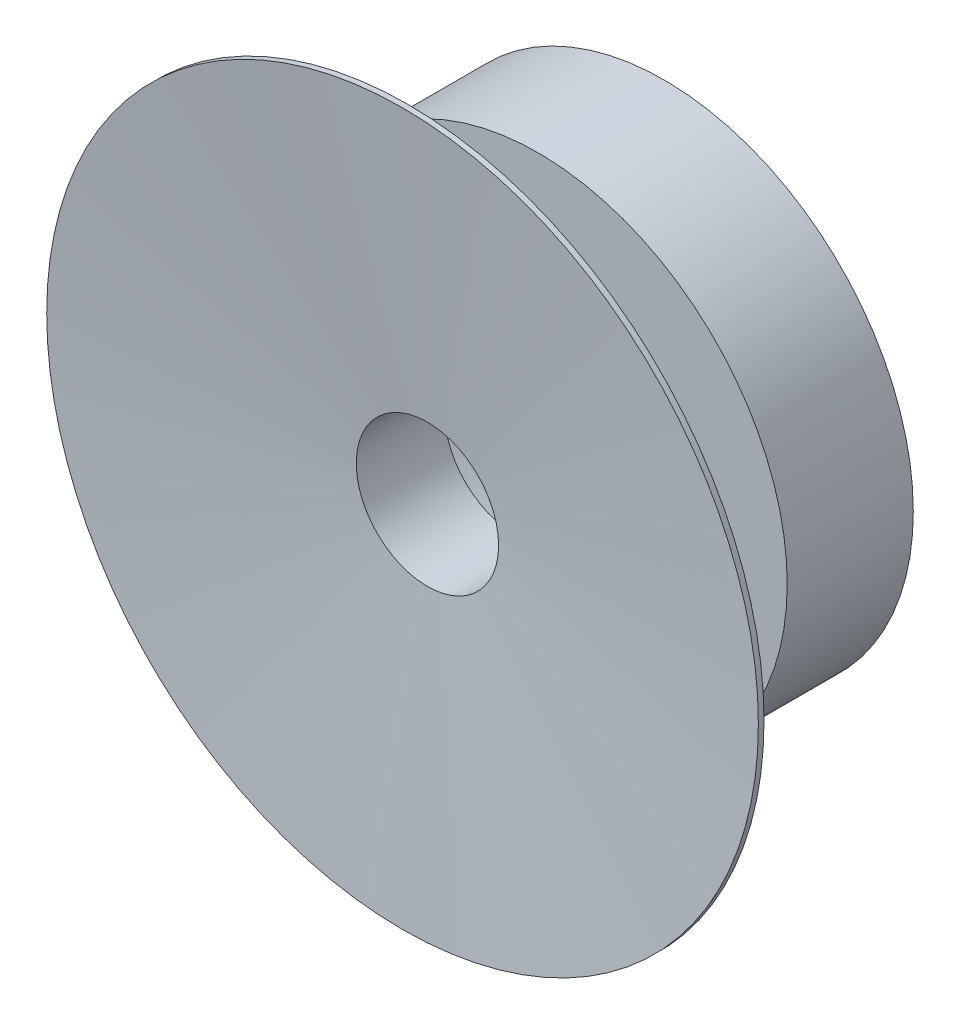
from build123d import *

# Parameters (mm, degrees)
SKETCH2_R             = 1.4732
BOSS_EXTRUDE1_DEPTH   = 10
FILLET2_R             = 3.175
CIRPATTERN2_START     = -49.5
CIRPATTERN2_OUTLINE_R = 1.4732
CIRPATTERN2_DEPTH     = 10


# Read off the part's stored shape, not the designer's step: CirPattern2
with BuildPart() as part:
    # Sketch1 → Revolve1 (revolve)
    with BuildSketch(Plane.YZ, mode=Mode.PRIVATE) as revolve1_sk:
        with BuildLine():
            ThreePointArc((-57.15, -39.5), (-43.428307314, -36.322800112), (-31.106422396, -29.5))
            Line((-31.106422396, -29.5), (-25.4, -29.5))
            Line((-25.4, -29.5), (-25.4, 2))
            Line((-25.4, 2), (-127, 10.888848214))
            Line((-127, 10.888848214), (-127, 8.881208539))
            Line((-127, 8.881208539), (-27.4, 0.167337652))
            Line((-27.4, 0.167337652), (-27.4, -23.683734158))
            ThreePointArc((-27.4, -23.683734158), (-41.079585236, -33.165904784), (-57.15, -37.5))
            Line((-57.15, -37.5), (-88.9, -37.5))
            Line((-88.9, -37.5), (-88.9, -82.5))
            Line((-88.9, -82.5), (-86.9, -82.5))
            Line((-86.9, -82.5), (-86.9, -39.5))
            Line((-86.9, -39.5), (-57.15, -39.5))
        make_face()
    revolve(revolve1_sk.sketch.rotate(Axis((0, 0, 14.051954895), (0, 0, -1)), 270), axis=Axis((0, 0, 14.051954895), (0, 0, -1)))

    # Sketch2 → Boss-Extrude1 (add)
    with BuildSketch(Plane(origin=(0, 0, -39.5), x_dir=(1, 0, 0), z_dir=(0, 0, -1))):
        with BuildLine():
            ThreePointArc((0, 57.15), (4, 57.009845641), (7.980380842, 56.590069991))
            ThreePointArc((7.980380842, 56.590069991), (29.37299875, 67.623432921), (53.425964916, 68.536678303))
            ThreePointArc((53.425964916, 68.536678303), (48.554411409, 72.069959989), (43.45, 75.257607589))
            ThreePointArc((43.45, 75.257607589), (19.913921564, 70.549566075), (0, 57.15))
        make_face()
        with Locations(Location((24.420129862, 69.15558596, 0), (0, 0, 180))):
            Circle(SKETCH2_R, mode=Mode.SUBTRACT)
    extrude(amount=BOSS_EXTRUDE1_DEPTH)

    # Fillet2
    fillet2_edges = [part.edges().sort_by_distance(p)[0] for p in [
        (53.425964916, -68.536678303, -44.5),
        (43.45, -75.257607589, -44.5),
    ]]
    fillet(fillet2_edges, radius=FILLET2_R)

    # CirPattern2 outline → CirPattern2 (add)
    # profile 1 of 11: a face of its own
    with BuildSketch(Plane.XY.offset(CIRPATTERN2_START)):
        with BuildLine():
            ThreePointArc((-21.383822454, -52.998628635), (-25.040821205, -51.371974591), (-28.575, -49.493351826))
            ThreePointArc((-28.575, -49.493351826), (-21.167907198, -66.538128805), (-8.985215302, -80.572781069))
            ThreePointArc((-8.985215302, -80.572781069), (-8.137140536, -84.282460346), (-11.457600483, -86.141357031))
            ThreePointArc((-11.457600483, -86.141357031), (0.680533064, -86.897335257), (12.805337694, -85.951342785))
            ThreePointArc((12.805337694, -85.951342785), (12.005662981, -85.968616711), (11.227047319, -85.785489194))
            ThreePointArc((11.227047319, -85.785489194), (-8.665120108, -72.959538869), (-21.383822454, -52.998628635))
        make_face()
        with Locations((-13.429340156, -72.100559186)):
            Circle(CIRPATTERN2_OUTLINE_R, mode=Mode.SUBTRACT)
    # profile 2 of 11: a face of its own
    with BuildSketch(Plane.XY.offset(CIRPATTERN2_START)):
        with BuildLine():
            ThreePointArc((-52.9932516, -68.871803264), (-42.859308707, -75.595566386), (-31.885923645, -80.838715188))
            ThreePointArc((-31.885923645, -80.838715188), (-32.587099225, -80.45383749), (-33.169836409, -79.905936578))
            ThreePointArc((-33.169836409, -79.905936578), (-43.983983575, -58.852254055), (-45.018247793, -35.206247537))
            ThreePointArc((-45.018247793, -35.206247537), (-47.371974591, -31.969024436), (-49.493351826, -28.575))
            ThreePointArc((-49.493351826, -28.575), (-51.601009781, -47.039756266), (-48.067815244, -65.285467609))
            ThreePointArc((-48.067815244, -65.285467609), (-49.188200591, -68.922181485), (-52.9932516, -68.871803264))
        make_face()
        with Locations((-47.680429324, -55.726245805)):
            Circle(CIRPATTERN2_OUTLINE_R, mode=Mode.SUBTRACT)
    # profile 3 of 11: a face of its own
    with BuildSketch(Plane.XY.offset(CIRPATTERN2_START)):
        with BuildLine():
            ThreePointArc((65.285467609, -48.067815244), (68.922181485, -49.188200591), (68.871803264, -52.9932516))
            ThreePointArc((68.871803264, -52.9932516), (75.595566386, -42.859308707), (80.838715188, -31.885923645))
            ThreePointArc((80.838715188, -31.885923645), (80.45383749, -32.587099225), (79.905936578, -33.169836409))
            ThreePointArc((79.905936578, -33.169836409), (58.852254055, -43.983983575), (35.206247537, -45.018247793))
            ThreePointArc((35.206247537, -45.018247793), (31.969024436, -47.371974591), (28.575, -49.493351826))
            ThreePointArc((28.575, -49.493351826), (47.039756266, -51.601009781), (65.285467609, -48.067815244))
        make_face()
        with Locations((55.726245805, -47.680429324)):
            Circle(CIRPATTERN2_OUTLINE_R, mode=Mode.SUBTRACT)
    # profile 4 of 11: a face of its own
    with BuildSketch(Plane.XY.offset(CIRPATTERN2_START)):
        with BuildLine():
            ThreePointArc((-80.329403747, -33.148105431), (-74.915033322, -44.03802655), (-68.033377494, -54.06541914))
            ThreePointArc((-68.033377494, -54.06541914), (-68.448174509, -53.381517486), (-68.678889259, -52.615652785))
            ThreePointArc((-68.678889259, -52.615652785), (-67.517374163, -28.975555294), (-56.590069991, -7.980380842))
            ThreePointArc((-56.590069991, -7.980380842), (-57.009845641, -4), (-57.15, 0))
            ThreePointArc((-57.15, 0), (-68.207663464, -14.937119024), (-74.27068291, -32.504965825))
            ThreePointArc((-74.27068291, -32.504965825), (-77.059322021, -35.094259755), (-80.329403747, -33.148105431))
        make_face()
        with Locations((-69.15558596, -24.420129862)):
            Circle(CIRPATTERN2_OUTLINE_R, mode=Mode.SUBTRACT)
    # profile 5 of 11: a face of its own
    with BuildSketch(Plane.XY.offset(CIRPATTERN2_START)):
        with BuildLine():
            ThreePointArc((80.572781069, -8.985215302), (84.282460346, -8.137140536), (86.141357031, -11.457600483))
            ThreePointArc((86.141357031, -11.457600483), (86.897335257, 0.680533064), (85.951342785, 12.805337694))
            ThreePointArc((85.951342785, 12.805337694), (85.968616711, 12.005662981), (85.785489194, 11.227047319))
            ThreePointArc((85.785489194, 11.227047319), (72.959538869, -8.665120108), (52.998628635, -21.383822454))
            ThreePointArc((52.998628635, -21.383822454), (51.371974591, -25.040821205), (49.493351826, -28.575))
            ThreePointArc((49.493351826, -28.575), (66.538128805, -21.167907198), (80.572781069, -8.985215302))
        make_face()
        with Locations((72.100559186, -13.429340156)):
            Circle(CIRPATTERN2_OUTLINE_R, mode=Mode.SUBTRACT)
    # profile 6 of 11: a face of its own
    with BuildSketch(Plane.XY.offset(CIRPATTERN2_START)):
        with BuildLine():
            ThreePointArc((-86.141357031, 11.457600483), (-86.897335257, -0.680533064), (-85.951342785, -12.805337694))
            ThreePointArc((-85.951342785, -12.805337694), (-85.968616711, -12.005662981), (-85.785489194, -11.227047319))
            ThreePointArc((-85.785489194, -11.227047319), (-72.959538869, 8.665120108), (-52.998628635, 21.383822454))
            ThreePointArc((-52.998628635, 21.383822454), (-51.371974591, 25.040821205), (-49.493351826, 28.575))
            ThreePointArc((-49.493351826, 28.575), (-66.538128805, 21.167907198), (-80.572781069, 8.985215302))
            ThreePointArc((-80.572781069, 8.985215302), (-84.282460346, 8.137140536), (-86.141357031, 11.457600483))
        make_face()
        with Locations((-72.100559186, 13.429340156)):
            Circle(CIRPATTERN2_OUTLINE_R, mode=Mode.SUBTRACT)
    # profile 7 of 11: a face of its own
    with BuildSketch(Plane.XY.offset(CIRPATTERN2_START)):
        with BuildLine():
            ThreePointArc((74.27068291, 32.504965825), (77.059322021, 35.094259755), (80.329403747, 33.148105431))
            ThreePointArc((80.329403747, 33.148105431), (74.915033322, 44.03802655), (68.033377494, 54.06541914))
            ThreePointArc((68.033377494, 54.06541914), (68.448174509, 53.381517486), (68.678889259, 52.615652785))
            ThreePointArc((68.678889259, 52.615652785), (67.517374163, 28.975555294), (56.590069991, 7.980380842))
            ThreePointArc((56.590069991, 7.980380842), (57.009845641, 4), (57.15, 0))
            ThreePointArc((57.15, 0), (68.207663464, 14.937119024), (74.27068291, 32.504965825))
        make_face()
        with Locations((69.15558596, 24.420129862)):
            Circle(CIRPATTERN2_OUTLINE_R, mode=Mode.SUBTRACT)
    # profile 8 of 11: a face of its own
    with BuildSketch(Plane.XY.offset(CIRPATTERN2_START)):
        with BuildLine():
            ThreePointArc((-68.871803264, 52.9932516), (-75.595566386, 42.859308707), (-80.838715188, 31.885923645))
            ThreePointArc((-80.838715188, 31.885923645), (-80.45383749, 32.587099225), (-79.905936578, 33.169836409))
            ThreePointArc((-79.905936578, 33.169836409), (-58.852254055, 43.983983575), (-35.206247537, 45.018247793))
            ThreePointArc((-35.206247537, 45.018247793), (-31.969024436, 47.371974591), (-28.575, 49.493351826))
            ThreePointArc((-28.575, 49.493351826), (-47.039756266, 51.601009781), (-65.285467609, 48.067815244))
            ThreePointArc((-65.285467609, 48.067815244), (-68.922181485, 49.188200591), (-68.871803264, 52.9932516))
        make_face()
        with Locations((-55.726245805, 47.680429324)):
            Circle(CIRPATTERN2_OUTLINE_R, mode=Mode.SUBTRACT)
    # profile 9 of 11: a face of its own
    with BuildSketch(Plane.XY.offset(CIRPATTERN2_START)):
        with BuildLine():
            ThreePointArc((48.067815244, 65.285467609), (49.188200591, 68.922181485), (52.9932516, 68.871803264))
            ThreePointArc((52.9932516, 68.871803264), (42.859308707, 75.595566386), (31.885923645, 80.838715188))
            ThreePointArc((31.885923645, 80.838715188), (32.587099225, 80.45383749), (33.169836409, 79.905936578))
            ThreePointArc((33.169836409, 79.905936578), (43.983983575, 58.852254055), (45.018247793, 35.206247537))
            ThreePointArc((45.018247793, 35.206247537), (47.371974591, 31.969024436), (49.493351826, 28.575))
            ThreePointArc((49.493351826, 28.575), (51.601009781, 47.039756266), (48.067815244, 65.285467609))
        make_face()
        with Locations((47.680429324, 55.726245805)):
            Circle(CIRPATTERN2_OUTLINE_R, mode=Mode.SUBTRACT)
    # profile 10 of 11: a face of its own
    with BuildSketch(Plane.XY.offset(CIRPATTERN2_START)):
        with BuildLine():
            ThreePointArc((-33.148105431, 80.329403747), (-44.03802655, 74.915033322), (-54.06541914, 68.033377494))
            ThreePointArc((-54.06541914, 68.033377494), (-53.381517486, 68.448174509), (-52.615652785, 68.678889259))
            ThreePointArc((-52.615652785, 68.678889259), (-28.975555294, 67.517374163), (-7.980380842, 56.590069991))
            ThreePointArc((-7.980380842, 56.590069991), (-4, 57.009845641), (0, 57.15))
            ThreePointArc((0, 57.15), (-14.937119024, 68.207663464), (-32.504965825, 74.27068291))
            ThreePointArc((-32.504965825, 74.27068291), (-35.094259755, 77.059322021), (-33.148105431, 80.329403747))
        make_face()
        with Locations((-24.420129862, 69.15558596)):
            Circle(CIRPATTERN2_OUTLINE_R, mode=Mode.SUBTRACT)
    # profile 11 of 11: a face of its own
    with BuildSketch(Plane.XY.offset(CIRPATTERN2_START)):
        with BuildLine():
            ThreePointArc((8.985215302, 80.572781069), (8.137140536, 84.282460346), (11.457600483, 86.141357031))
            ThreePointArc((11.457600483, 86.141357031), (-0.680533064, 86.897335257), (-12.805337694, 85.951342785))
            ThreePointArc((-12.805337694, 85.951342785), (-12.005662981, 85.968616711), (-11.227047319, 85.785489194))
            ThreePointArc((-11.227047319, 85.785489194), (8.665120108, 72.959538869), (21.383822454, 52.998628635))
            ThreePointArc((21.383822454, 52.998628635), (25.040821205, 51.371974591), (28.575, 49.493351826))
            ThreePointArc((28.575, 49.493351826), (21.167907198, 66.538128805), (8.985215302, 80.572781069))
        make_face()
        with Locations((13.429340156, 72.100559186)):
            Circle(CIRPATTERN2_OUTLINE_R, mode=Mode.SUBTRACT)
    extrude(amount=CIRPATTERN2_DEPTH)


solid = part.part
